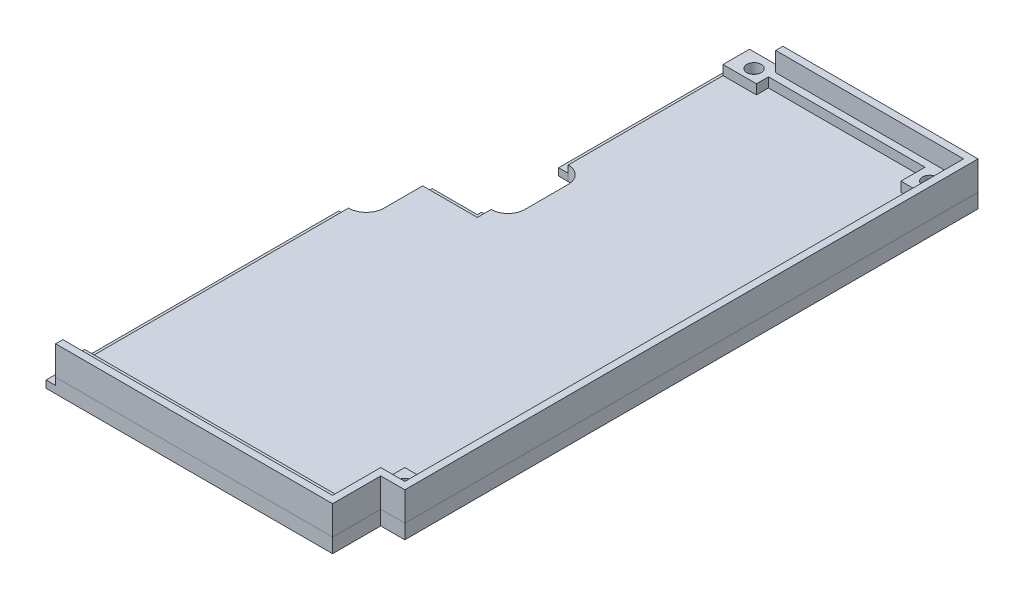
from build123d import *

# Parameters (mm, degrees)
SKETCH2_R                 = 1.5
BOSS_EXTRUDE1_DEPTH       = 3
BOSS_EXTRUDE2_DEPTH       = 6
BOSS_EXTRUDE2_2_OUTLINE_R = 1.5
BOSS_EXTRUDE2_2_DEPTH     = 2
CUT_EXTRUDE1_DEPTH        = 10
CUT_EXTRUDE2_DEPTH        = 20
SKETCH6_W                 = 2
SKETCH6_H                 = 37.630998281
SKETCH6_H_2               = 60.8
EXTRUDE_THIN1_DEPTH       = 1.5


# Read off the part's stored shape, not the designer's step: Boss-Extrude2
with BuildPart() as part:
    # Sketch2 → Boss-Extrude1 (new body)
    with BuildSketch(Plane(origin=(0, 7, 0), x_dir=(1, 0, 0), z_dir=(0, 1, 0))):
        Polygon((-57.5, -54.5), (-57.5, -64.5), (57.5, -64.5), (57.5, -54.5), (62.5, -54.5), (62.5, 64.5), (-62.5, 64.5), (-62.5, -54.5), align=None)
        with BuildLine():
            ThreePointArc((-57.185427384, -50.966643811), (-57.444119701, -50.998958769), (-57.7045, -50.985994532))
            ThreePointArc((-57.7045, -50.985994532), (-59, -49.5), (-57.7045, -48.014005468))
            ThreePointArc((-57.7045, -48.014005468), (-57.444119701, -48.001041231), (-57.185427384, -48.033356189))
            ThreePointArc((-57.185427384, -48.033356189), (-56, -49.5), (-57.185427384, -50.966643811))
        make_face(mode=Mode.SUBTRACT)
        with Locations(Location((57.5, -49.5, 0), (0, 0, 180))):
            Circle(SKETCH2_R, mode=Mode.SUBTRACT)
        with Locations(Location((-57.5, 59.5, 0), (0, 0, 180))):
            Circle(SKETCH2_R, mode=Mode.SUBTRACT)
        with Locations(Location((-19, 61.5, 0), (0, 0, 180))):
            Circle(SKETCH2_R, mode=Mode.SUBTRACT)
        with Locations(Location((19, 61.5, 0), (0, 0, 180))):
            Circle(SKETCH2_R, mode=Mode.SUBTRACT)
        with Locations(Location((57.5, 59.5, 0), (0, 0, 180))):
            Circle(SKETCH2_R, mode=Mode.SUBTRACT)
    extrude(amount=-BOSS_EXTRUDE1_DEPTH)

    # Sketch4 → Cut-Extrude1 (cut)
    with BuildSketch(Plane.XZ.offset(-4)):
        with BuildLine():
            Line((-3.7, -8), (-3.7, 0))
            ThreePointArc((-3.7, 0), (0, 3.7), (3.7, 0))
            Line((3.7, 0), (3.7, -8))
            ThreePointArc((3.7, -8), (0, -11.7), (-3.7, -8))
        make_face()
        with BuildLine():
            Line((11.55579566, -23.369001719), (11.55579566, -14.369001719))
            ThreePointArc((11.55579566, -14.369001719), (15.05579566, -10.869001719), (18.55579566, -14.369001719))
            Line((18.55579566, -14.369001719), (18.55579566, -23.369001719))
            ThreePointArc((18.55579566, -23.369001719), (15.05579566, -26.869001719), (11.55579566, -23.369001719))
        make_face()
    extrude(amount=-CUT_EXTRUDE1_DEPTH, mode=Mode.SUBTRACT)


with BuildPart() as body_2:
    # Boss-Extrude2 outline → Boss-Extrude2 (new body)
    with BuildSketch(Plane(origin=(0, 7, 0), x_dir=(1, 0, 0), z_dir=(0, 1, 0))):
        Polygon((-61, 63), (-22, 63), (-22, 64.5), (-62.5, 64.5), (-62.5, -54.5), (-57.5, -54.5), (-57.5, -64.5), (57.5, -64.5), (57.5, -54.5), (62.5, -54.5), (62.5, 64.5), (22, 64.5), (22, 63), (61, 63), (61, -53), (56, -53), (56, -63), (-56, -63), (-56, -53), (-61, -53), align=None)
    extrude(amount=BOSS_EXTRUDE2_DEPTH)

    # Boss-Extrude2 2 outline → Boss-Extrude2 2 (add)
    with BuildSketch(Plane(origin=(0, 7, 0), x_dir=(1, 0, 0), z_dir=(0, 1, 0))):
        Polygon((-22, 64.5), (-22, 63), (-61, 63), (-61, -53), (-56, -53), (-56, -63), (56, -63), (56, -53), (61, -53), (61, 63), (22, 63), (22, 64.5), align=None)
        with Locations((-57.5, -49.5)):
            Circle(BOSS_EXTRUDE2_2_OUTLINE_R, mode=Mode.SUBTRACT)
        with Locations((57.5, -49.5)):
            Circle(BOSS_EXTRUDE2_2_OUTLINE_R, mode=Mode.SUBTRACT)
        with Locations((-57.5, 59.5)):
            Circle(BOSS_EXTRUDE2_2_OUTLINE_R, mode=Mode.SUBTRACT)
        with Locations((-19, 61.5)):
            Circle(BOSS_EXTRUDE2_2_OUTLINE_R, mode=Mode.SUBTRACT)
        Polygon((-22, 61.5), (-22, 59), (22, 59), (22, 61.5), (54.5, 61.5), (54.5, 56.5), (59.5, 56.5), (59.5, -46.5), (54.5, -46.5), (54.5, -58.5), (-54.5, -58.5), (-54.5, -46.5), (-59.5, -46.5), (-59.5, 56.5), (-54.5, 56.5), (-54.5, 61.5), align=None, mode=Mode.SUBTRACT)
        with Locations((19, 61.5)):
            Circle(BOSS_EXTRUDE2_2_OUTLINE_R, mode=Mode.SUBTRACT)
        with Locations((57.5, 59.5)):
            Circle(BOSS_EXTRUDE2_2_OUTLINE_R, mode=Mode.SUBTRACT)
    extrude(amount=BOSS_EXTRUDE2_2_DEPTH)


with BuildPart() as cut_extrude2_tool:
    # Sketch5 → Cut-Extrude2 (new body)
    with BuildSketch(Plane.XZ.offset(-4)):
        Polygon((15.05579566, -18.869001719), (15.05579566, -64.5), (-62.5, -64.5), (-62.5, 54.5), (-57.5, 54.5), (-57.5, 64.5), (0, 64.5), (0, -8), (15.05579566, -8), align=None)
    extrude(amount=-CUT_EXTRUDE2_DEPTH)


with BuildPart() as part_1:
    add(part.part)

    # Cut-Extrude2: cut by cut_extrude2_tool
    add(cut_extrude2_tool.part, mode=Mode.SUBTRACT)

    # Sketch6 → Extrude-Thin1 (add)
    with BuildSketch(Plane.XZ.offset(-4)):
        with Locations((14.05579566, -45.68450086)):
            Rectangle(SKETCH6_W, SKETCH6_H)
        Polygon((15.05579566, -10.869001719), (15.05579566, -8), (3.7, -8), (3.7, -10), (13.05579566, -10), (13.05579566, -10.869001719), align=None)
        with Locations((-1, 34.1)):
            Rectangle(SKETCH6_W, SKETCH6_H_2)
    extrude(amount=-EXTRUDE_THIN1_DEPTH)


with BuildPart() as body_2_1:
    add(body_2.part)

    # Cut-Extrude2: cut by cut_extrude2_tool
    add(cut_extrude2_tool.part, mode=Mode.SUBTRACT)


solid = Compound([part_1.part, body_2_1.part])
